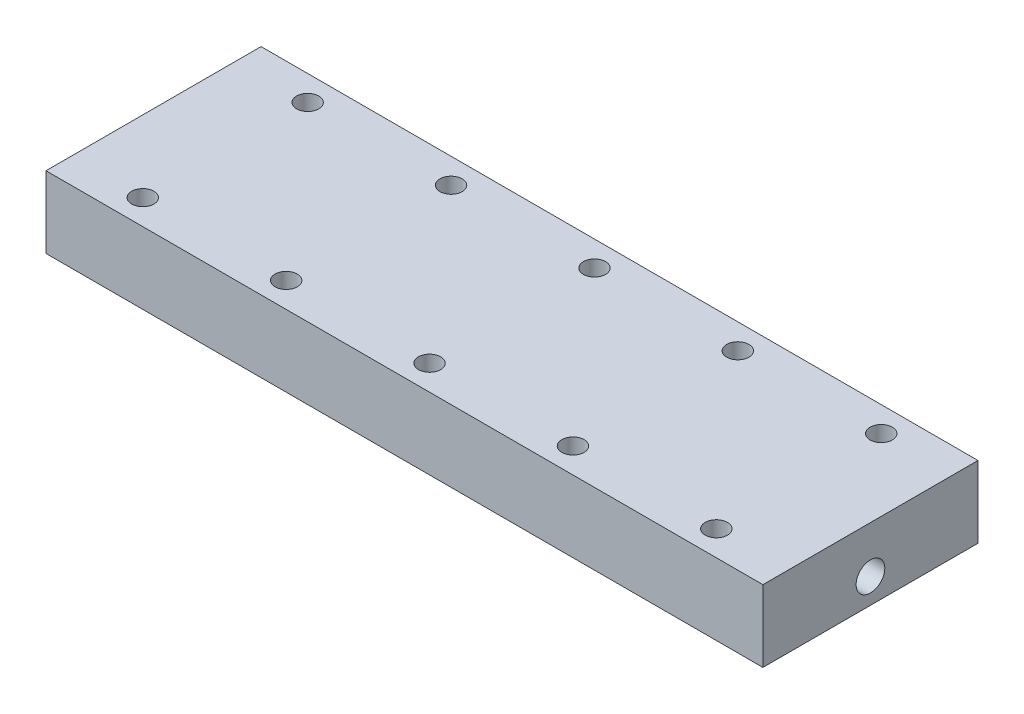
from build123d import *

# Parameters (mm, degrees)
SKETCH1_W               = 100
SKETCH1_H               = 30
BOSS_EXTRUDE1_DEPTH     = 10
CUT_EXTRUDE1_DEPTH      = 8.5
CUT_EXTRUDE1_DEPTH_BACK = 8.5
SKETCH2_W               = 30
SKETCH2_H               = 18
SKETCH4_W               = 10
SKETCH4_H               = 18
BOSS_EXTRUDE2_DEPTH     = 10
REVOLVE1_ANGLE          = 180
REVOLVE2_ANGLE          = 180
REVOLVE3_ANGLE          = 180
SKETCH9_R               = 1
CUT_EXTRUDE2_DEPTH      = 12
SKETCH10_R              = 2
CUT_EXTRUDE3_DEPTH      = 12
FILLET3_R               = 1.2
FILLET5_R               = 1.25
FILLET7_R               = 2
CUT_EXTRUDE4_DEPTH      = 20
CUT_EXTRUDE4_DEPTH_BACK = 20
SKETCH11_R              = 1.55


with BuildPart() as part:
    # Sketch1 → Boss-Extrude1 (new body)
    with BuildSketch(Plane(origin=(0, 0, 0), x_dir=(1, 0, 0), z_dir=(0, 1, 0))):
        with Locations((0, 15)):
            Rectangle(SKETCH1_W, SKETCH1_H)
    extrude(amount=BOSS_EXTRUDE1_DEPTH)

    # Sketch2 → Cut-Extrude1 (cut, two sides: drawn at the far end of the back side and taken through both)
    with BuildSketch(Plane(origin=(0, 0, 0), x_dir=(1, 0, 0), z_dir=(0, 1, 0)).offset(-CUT_EXTRUDE1_DEPTH_BACK)):
        with Locations((30, 15)):
            Rectangle(SKETCH2_W, SKETCH2_H)
    extrude(amount=CUT_EXTRUDE1_DEPTH + CUT_EXTRUDE1_DEPTH_BACK, mode=Mode.SUBTRACT)

    # Sketch4 → Boss-Extrude2 (add)
    with BuildSketch(Plane(origin=(0, 0, 0), x_dir=(1, 0, 0), z_dir=(0, 1, 0))):
        with Locations((20, 15)):
            Rectangle(SKETCH4_W, SKETCH4_H)
    extrude(amount=BOSS_EXTRUDE2_DEPTH)

    # Sketch3 → Cut-Revolve1 (revolve, cut)
    with BuildSketch(Plane(origin=(0, 0, 0), x_dir=(1, 0, 0), z_dir=(0, 1, 0))):
        Polygon((-45, 15), (-45, 8.41), (35, 6.89), (35, 15), align=None)
    revolve(axis=Axis((50, 0, -15), (-1, 0, 0)), mode=Mode.SUBTRACT)

    # Sketch6 → Revolve1 (revolve)
    with BuildSketch(Plane(origin=(0, 0, 0), x_dir=(1, 0, 0), z_dir=(0, 1, 0))):
        Polygon((25, 22.92), (25, 20.42), (15.047727794, 20.23), (15, 22.73), align=None)
    revolve(axis=Axis((-50, 0, -15), (1, 0, 0)), revolution_arc=REVOLVE1_ANGLE)

    # Sketch7 → Revolve2 (revolve)
    with BuildSketch(Plane(origin=(0, 0, 0), x_dir=(1, 0, 0), z_dir=(0, 1, 0))):
        Polygon((-35, 21.78), (-22.5, 22.0175), (-22.5, 19.5175), (-35, 19.28), align=None)
    revolve(axis=Axis((-45, 0, -15), (1, 0, 0)), revolution_arc=REVOLVE2_ANGLE)

    # Sketch8 → Revolve3 (revolve)
    with BuildSketch(Plane(origin=(0, 0, 0), x_dir=(1, 0, 0), z_dir=(0, 1, 0))):
        Polygon((-10, 22.255), (-10, 19.755), (2.5, 19.9925), (2.5, 22.4925), align=None)
    revolve(axis=Axis((-45, 0, -15), (1, 0, 0)), revolution_arc=REVOLVE3_ANGLE)

    # Sketch9 → Cut-Extrude2 (cut)
    with BuildSketch(Plane.ZY.offset(50)):
        with Locations((-15, 3.5)):
            Circle(SKETCH9_R)
    extrude(amount=-CUT_EXTRUDE2_DEPTH, mode=Mode.SUBTRACT)

    # Sketch10 → Cut-Extrude3 (cut)
    with BuildSketch(Plane(origin=(50, 0, 0), x_dir=(0, 0, -1), z_dir=(1, 0, 0))):
        with Locations((15, 3.5)):
            Circle(SKETCH10_R)
    extrude(amount=-CUT_EXTRUDE3_DEPTH, mode=Mode.SUBTRACT)

    # Fillet3
    fillet3_edges = [part.edges().sort_by_distance(p)[0] for p in [
        (15.047727794, 5.23, -15),
        (15, 7.73, -15),
        (-10, 7.255, -15),
        (2.5, 7.4925, -15),
        (2.5, 4.9925, -15),
        (-10, 4.755, -15),
        (-22.5, 7.0175, -15),
        (-22.5, 4.5175, -15),
        (-35, 6.78, -15),
        (-35, 4.28, -15),
    ]]
    fillet(fillet3_edges, radius=FILLET3_R)

    # Fillet5
    fillet5_edges = [part.edges().sort_by_distance(p)[0] for p in [
        (25, 5.42, -15),
    ]]
    fillet(fillet5_edges, radius=FILLET5_R)

    # Fillet7
    fillet7_edges = [part.edges().sort_by_distance(p)[0] for p in [
        (25, 4.25, -24),
        (25, 4.25, -6),
        (45, 4.25, -24),
        (35, 8.5, -24),
        (45, 4.25, -6),
        (45, 8.5, -15),
        (35, 8.5, -6),
        (25, 8.5, -15),
    ]]
    fillet(fillet7_edges, radius=FILLET7_R)

    # Sketch11 → Cut-Extrude4 (cut, two sides: drawn at the far end of the back side and taken through both)
    with BuildSketch(Plane(origin=(0, 0, 0), x_dir=(1, 0, 0), z_dir=(0, 1, 0)).offset(-CUT_EXTRUDE4_DEPTH_BACK)):
        with Locations((-40, 3.5)):
            Circle(SKETCH11_R)
        with Locations((-20, 3.5)):
            Circle(SKETCH11_R)
        with Locations((0, 3.5)):
            Circle(SKETCH11_R)
        with Locations((20, 3.5)):
            Circle(SKETCH11_R)
        with Locations((40, 3.5)):
            Circle(SKETCH11_R)
        with Locations((-40, 26.5)):
            Circle(SKETCH11_R)
        with Locations((-20, 26.5)):
            Circle(SKETCH11_R)
        with Locations((0, 26.5)):
            Circle(SKETCH11_R)
        with Locations((20, 26.5)):
            Circle(SKETCH11_R)
        with Locations((40, 26.5)):
            Circle(SKETCH11_R)
    extrude(amount=CUT_EXTRUDE4_DEPTH + CUT_EXTRUDE4_DEPTH_BACK, mode=Mode.SUBTRACT)


solid = part.part
